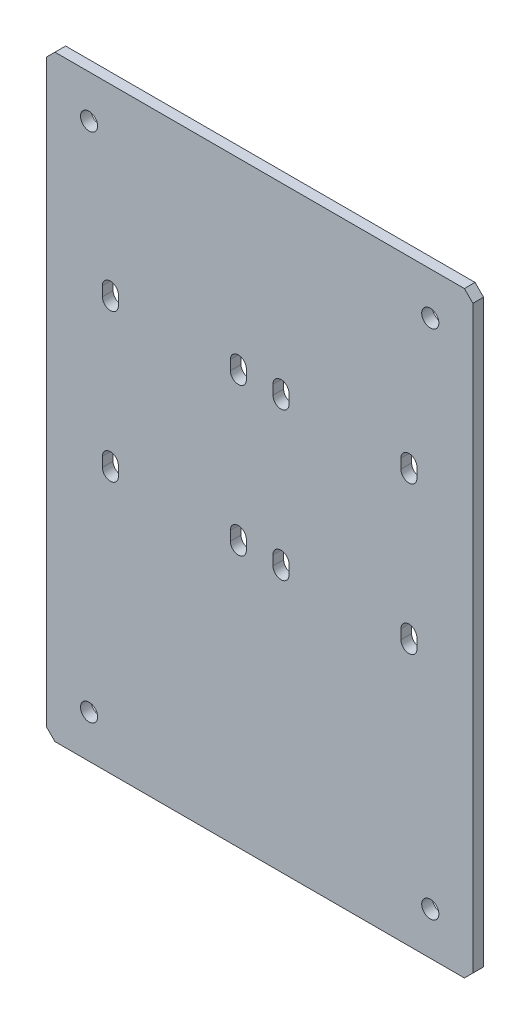
from build123d import *

# Parameters (mm, degrees)
SKETCH1_W              = 127
SKETCH1_H              = 177.8
BOSS_EXTRUDE1_DEPTH    = 3.175
CUT_EXTRUDE1_DEPTH     = 219.522128456
F_10_CLEARANCE_HOLE1_D = 5.1054
CHAMFER1_SIZE          = 2.54


with BuildPart() as part:
    # Sketch1 → Boss-Extrude1 (new body)
    with BuildSketch(Plane.XY):
        with Locations((63.5, 88.9)):
            Rectangle(SKETCH1_W, SKETCH1_H)
    extrude(amount=-BOSS_EXTRUDE1_DEPTH)

    # Sketch2 → Cut-Extrude1 (cut, through all)
    with BuildSketch(Plane.XY):
        with BuildLine():
            Line((16.66875, 121.7875), (16.66875, 124.645))
            ThreePointArc((16.66875, 124.645), (19.05, 127.02625), (21.43125, 124.645))
            Line((21.43125, 124.645), (21.43125, 121.7875))
            ThreePointArc((21.43125, 121.7875), (19.05, 119.40625), (16.66875, 121.7875))
        make_face()
        with BuildLine():
            Line((16.66875, 77.7875), (16.66875, 80.645))
            ThreePointArc((16.66875, 80.645), (19.05, 83.02625), (21.43125, 80.645))
            Line((21.43125, 80.645), (21.43125, 77.7875))
            ThreePointArc((21.43125, 77.7875), (19.05, 75.40625), (16.66875, 77.7875))
        make_face()
        with BuildLine():
            Line((59.53125, 124.645), (59.53125, 121.7875))
            ThreePointArc((59.53125, 121.7875), (57.15, 119.40625), (54.76875, 121.7875))
            Line((54.76875, 121.7875), (54.76875, 124.645))
            ThreePointArc((54.76875, 124.645), (57.15, 127.02625), (59.53125, 124.645))
        make_face()
        with BuildLine():
            Line((59.53125, 80.645), (59.53125, 77.7875))
            ThreePointArc((59.53125, 77.7875), (57.15, 75.40625), (54.76875, 77.7875))
            Line((54.76875, 77.7875), (54.76875, 80.645))
            ThreePointArc((54.76875, 80.645), (57.15, 83.02625), (59.53125, 80.645))
        make_face()
        with BuildLine():
            Line((110.33125, 121.7875), (110.33125, 124.645))
            ThreePointArc((110.33125, 124.645), (107.95, 127.02625), (105.56875, 124.645))
            Line((105.56875, 124.645), (105.56875, 121.7875))
            ThreePointArc((105.56875, 121.7875), (107.95, 119.40625), (110.33125, 121.7875))
        make_face()
        with BuildLine():
            Line((110.33125, 77.7875), (110.33125, 80.645))
            ThreePointArc((110.33125, 80.645), (107.95, 83.02625), (105.56875, 80.645))
            Line((105.56875, 80.645), (105.56875, 77.7875))
            ThreePointArc((105.56875, 77.7875), (107.95, 75.40625), (110.33125, 77.7875))
        make_face()
        with BuildLine():
            Line((67.46875, 124.645), (67.46875, 121.7875))
            ThreePointArc((67.46875, 121.7875), (69.85, 119.40625), (72.23125, 121.7875))
            Line((72.23125, 121.7875), (72.23125, 124.645))
            ThreePointArc((72.23125, 124.645), (69.85, 127.02625), (67.46875, 124.645))
        make_face()
        with BuildLine():
            Line((67.46875, 80.645), (67.46875, 77.7875))
            ThreePointArc((67.46875, 77.7875), (69.85, 75.40625), (72.23125, 77.7875))
            Line((72.23125, 77.7875), (72.23125, 80.645))
            ThreePointArc((72.23125, 80.645), (69.85, 83.02625), (67.46875, 80.645))
        make_face()
    extrude(amount=-CUT_EXTRUDE1_DEPTH, mode=Mode.SUBTRACT)

    # #10 Clearance Hole1 (through all)
    with Locations(Plane.XY):
        with Locations((12.7, 12.7), (12.7, 165.1), (114.3, 165.1), (114.3, 12.7)):
            Hole(F_10_CLEARANCE_HOLE1_D / 2)

    # Chamfer1
    chamfer1_edges = [part.edges().sort_by_distance(p)[0] for p in [
        (0, 0, -1.5875),
        (127, 0, -1.5875),
        (127, 177.8, -1.5875),
        (0, 177.8, -1.5875),
    ]]
    chamfer(chamfer1_edges, length=CHAMFER1_SIZE)


solid = part.part
